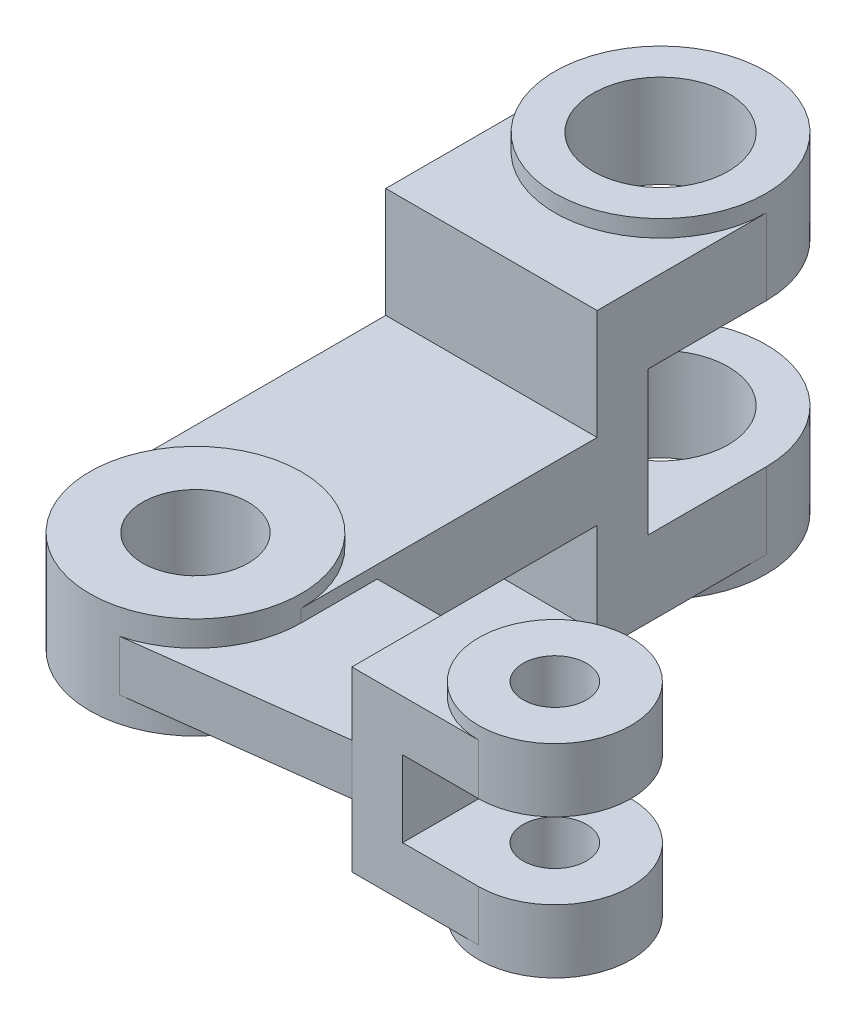
from build123d import *

# Parameters (mm, degrees)
BOSS_EXTRUDE2_DEPTH     = 35
CUT_EXTRUDE1_DEPTH      = 59.736700622
CUT_EXTRUDE1_DEPTH_BACK = 59.736700622
SKETCH2_W               = 34
SKETCH2_H               = 53
BOSS_EXTRUDE3_START     = 4
SKETCH3_R               = 25
SKETCH3_R_2             = 16
BOSS_EXTRUDE3_DEPTH     = 4
BOSS_EXTRUDE4_DEPTH     = 9
BOSS_EXTRUDE5_START     = 3
SKETCH5_R               = 25
SKETCH5_R_2             = 12.5
BOSS_EXTRUDE5_DEPTH     = 3
BOSS_EXTRUDE6_DEPTH     = 24
CUT_EXTRUDE2_DEPTH      = 189.517903659
CUT_EXTRUDE2_DEPTH_BACK = 189.517903659
SKETCH7_W               = 49.579058297
SKETCH7_H               = 18
CUT_EXTRUDE3_DEPTH      = 182.115984938
CUT_EXTRUDE3_DEPTH_BACK = 182.115984938
SKETCH8_R               = 7.5
CUT_EXTRUDE4_DEPTH      = 3
BOSS_EXTRUDE8_DEPTH     = 6
CUT_EXTRUDE5_DEPTH      = 186.229587269
CUT_EXTRUDE5_DEPTH_BACK = 186.229587269
SKETCH12_R              = 16
CUT_EXTRUDE6_DEPTH      = 177.459627111
CUT_EXTRUDE6_DEPTH_BACK = 177.459627111
SKETCH13_R              = 12.5


with BuildPart() as part:
    # Sketch1 → Boss-Extrude2 (new, symmetric)
    with BuildSketch(Plane(origin=(0, 0, 0), x_dir=(-1, 0, 0), z_dir=(0, 1, 0))):
        with BuildLine():
            Line((-25, 0), (-25, 40))
            Line((-25, 40), (25, 40))
            Line((25, 40), (25, 0))
            ThreePointArc((25, 0), (0, -25), (-25, 0))
        make_face()
    extrude(amount=BOSS_EXTRUDE2_DEPTH, both=True)

    # Sketch2 → Cut-Extrude1 (cut, two sides: drawn at the far end of the back side and taken through both)
    with BuildSketch(Plane.YZ.offset(-CUT_EXTRUDE1_DEPTH_BACK)):
        with Locations((0, 1.5)):
            Rectangle(SKETCH2_W, SKETCH2_H)
    extrude(amount=CUT_EXTRUDE1_DEPTH + CUT_EXTRUDE1_DEPTH_BACK, mode=Mode.SUBTRACT)

    # Sketch3 → Boss-Extrude3 (add)
    with BuildSketch(Plane(origin=(0, 35, 0), x_dir=(-1, 0, 0), z_dir=(0, 1, 0)).offset(BOSS_EXTRUDE3_START)):
        Circle(SKETCH3_R)
        Circle(SKETCH3_R_2, mode=Mode.SUBTRACT)
    boss_extrude3 = extrude(amount=-BOSS_EXTRUDE3_DEPTH)

    # Mirror1: Boss-Extrude3 across plane
    add(boss_extrude3.mirror(Plane.ZX))

    # Sketch4 → Boss-Extrude4 (add, symmetric)
    with BuildSketch(Plane(origin=(0, 0, 0), x_dir=(-1, 0, 0), z_dir=(0, 1, 0))):
        with BuildLine():
            Line((-25, 40), (25, 40))
            Line((25, 40), (25, 110))
            ThreePointArc((25, 110), (0, 135), (-25, 110))
            Line((-25, 110), (-25, 40))
        make_face()
    extrude(amount=BOSS_EXTRUDE4_DEPTH, both=True)

    # Sketch5 → Boss-Extrude5 (add)
    with BuildSketch(Plane(origin=(0, 9, 0), x_dir=(-1, 0, 0), z_dir=(0, 1, 0)).offset(BOSS_EXTRUDE5_START)):
        with Locations((0, 110)):
            Circle(SKETCH5_R)
        with Locations((0, 110)):
            Circle(SKETCH5_R_2, mode=Mode.SUBTRACT)
    boss_extrude5 = extrude(amount=-BOSS_EXTRUDE5_DEPTH)

    # Mirror2: Boss-Extrude5 across plane
    add(boss_extrude5.mirror(Plane.ZX))



with BuildPart() as body_2:
    # Sketch6 → Boss-Extrude6 (new, symmetric)
    with BuildSketch(Plane(origin=(0, 0, 0), x_dir=(-1, 0, 0), z_dir=(0, 1, 0))):
        with BuildLine():
            Line((-85, 128), (-55, 128))
            Line((-55, 128), (-55, 92))
            Line((-55, 92), (-85, 92))
            ThreePointArc((-85, 92), (-103, 110), (-85, 128))
        make_face()
    extrude(amount=BOSS_EXTRUDE6_DEPTH, both=True)

    # Sketch7 → Cut-Extrude2 (cut, two sides: drawn at the far end of the back side and taken through both)
    with BuildSketch(Plane.XY.offset(128).offset(-CUT_EXTRUDE2_DEPTH_BACK)):
        with Locations((91.789529149, 0)):
            Rectangle(SKETCH7_W, SKETCH7_H)
    extrude(amount=CUT_EXTRUDE2_DEPTH + CUT_EXTRUDE2_DEPTH_BACK, mode=Mode.SUBTRACT)

    # Sketch8 → Cut-Extrude3 (cut, two sides: drawn at the far end of the back side and taken through both)
    with BuildSketch(Plane(origin=(0, 24, 0), x_dir=(-1, 0, 0), z_dir=(0, 1, 0)).offset(-CUT_EXTRUDE3_DEPTH_BACK)):
        with Locations((-85, 110)):
            Circle(SKETCH8_R)
    extrude(amount=CUT_EXTRUDE3_DEPTH + CUT_EXTRUDE3_DEPTH_BACK, mode=Mode.SUBTRACT)

    # Sketch9 → Cut-Extrude4 (cut)
    with BuildSketch(Plane(origin=(0, 24, 0), x_dir=(-1, 0, 0), z_dir=(0, 1, 0))):
        with BuildLine():
            Line((-85, 128), (-55, 128))
            Line((-55, 128), (-55, 92))
            Line((-55, 92), (-85, 92))
            ThreePointArc((-85, 92), (-67, 110), (-85, 128))
        make_face()
    cut_extrude4 = extrude(amount=-CUT_EXTRUDE4_DEPTH, mode=Mode.SUBTRACT)

    # Mirror3: Cut-Extrude4 across plane
    add(cut_extrude4.mirror(Plane.ZX), mode=Mode.SUBTRACT)


with BuildPart() as part_1:
    add(part.part)

    add(body_2.part)  # Boss-Extrude8 merges body 2
    # Sketch11 → Boss-Extrude8 (add, symmetric)
    with BuildSketch(Plane(origin=(0, 0, 0), x_dir=(-1, 0, 0), z_dir=(0, 1, 0))):
        with BuildLine():
            ThreePointArc((-25, 110), (-19.76809269, 125.304329825), (-6.262199089, 134.202992843))
            Line((-6.262199089, 134.202992843), (-55, 128))
            Line((-55, 128), (-55, 92))
            Line((-55, 92), (-25, 92))
            Line((-25, 92), (-25, 110))
        make_face()
    extrude(amount=BOSS_EXTRUDE8_DEPTH, both=True)

    # Sketch12 → Cut-Extrude5 (cut, two sides: drawn at the far end of the back side and taken through both)
    with BuildSketch(Plane.XZ.offset(35).offset(-CUT_EXTRUDE5_DEPTH_BACK)):
        Circle(SKETCH12_R)
    extrude(amount=CUT_EXTRUDE5_DEPTH + CUT_EXTRUDE5_DEPTH_BACK, mode=Mode.SUBTRACT)

    # Sketch13 → Cut-Extrude6 (cut, two sides: drawn at the far end of the back side and taken through both)
    with BuildSketch(Plane.XZ.offset(9).offset(-CUT_EXTRUDE6_DEPTH_BACK)):
        with Locations((0, 110)):
            Circle(SKETCH13_R)
    extrude(amount=CUT_EXTRUDE6_DEPTH + CUT_EXTRUDE6_DEPTH_BACK, mode=Mode.SUBTRACT)


solid = part_1.part
